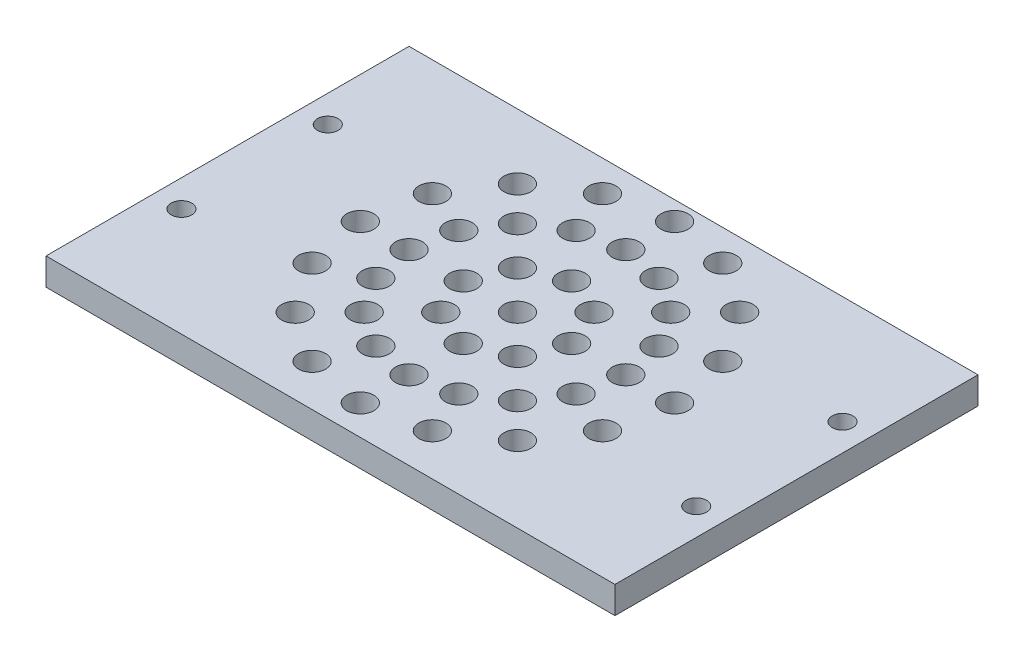
from build123d import *

# Parameters (mm, degrees)
SKETCH1_W           = 133.35
SKETCH1_H           = 85.09
BOSS_EXTRUDE1_DEPTH = 6.35
SKETCH2_R           = 2.413
CUT_EXTRUDE1_DEPTH  = 101.417876049
SKETCH3_R           = 3.175
CUT_EXTRUDE7_DEPTH  = 101.417876049


with BuildPart() as part:
    # Sketch1 → Boss-Extrude1 (new body)
    with BuildSketch(Plane(origin=(0, 0, 0), x_dir=(1, 0, 0), z_dir=(0, 1, 0))):
        with Locations((21.486627907, 5.109534884)):
            Rectangle(SKETCH1_W, SKETCH1_H)
    extrude(amount=BOSS_EXTRUDE1_DEPTH)

    # Sketch2 → Cut-Extrude1 (cut, through all)
    with BuildSketch(Plane(origin=(0, 6.35, 0), x_dir=(1, 0, 0), z_dir=(0, 1, 0))):
        with Locations((81.811627907, -12.035465116)):
            Circle(SKETCH2_R)
        with Locations((81.811627907, 22.254534884)):
            Circle(SKETCH2_R)
        with Locations((-38.838372093, 22.254534884)):
            Circle(SKETCH2_R)
        with Locations((-38.838372093, -12.035465116)):
            Circle(SKETCH2_R)
    extrude(amount=-CUT_EXTRUDE1_DEPTH, mode=Mode.SUBTRACT)

    # Sketch3 → Cut-Extrude7 (cut, through all)
    with BuildSketch(Plane(origin=(0, 6.35, 0), x_dir=(1, 0, 0), z_dir=(0, 1, 0))):
        with Locations((21.486627907, 6.379534884)):
            Circle(SKETCH3_R)
        with Locations((34.186627907, 6.379534884)):
            Circle(SKETCH3_R)
        with Locations((46.886627907, 6.379534884)):
            Circle(SKETCH3_R)
        with Locations((30.466884028, -2.600721237)):
            Circle(SKETCH3_R)
        with Locations((21.486627907, -6.320465116)):
            Circle(SKETCH3_R)
        with Locations((12.506371786, -2.600721237)):
            Circle(SKETCH3_R)
        with Locations((8.786627907, 6.379534884)):
            Circle(SKETCH3_R)
        with Locations((12.506371786, 15.359791005)):
            Circle(SKETCH3_R)
        with Locations((21.486627907, 19.079534884)):
            Circle(SKETCH3_R)
        with Locations((30.466884028, 15.359791005)):
            Circle(SKETCH3_R)
        with Locations((44.953168033, -3.340624298)):
            Circle(SKETCH3_R)
        with Locations((39.447140149, -11.580977358)):
            Circle(SKETCH3_R)
        with Locations((31.206787089, -17.087005242)):
            Circle(SKETCH3_R)
        with Locations((21.486627907, -19.020465116)):
            Circle(SKETCH3_R)
        with Locations((11.766468725, -17.087005242)):
            Circle(SKETCH3_R)
        with Locations((3.526115665, -11.580977358)):
            Circle(SKETCH3_R)
        with Locations((-1.979912219, -3.340624298)):
            Circle(SKETCH3_R)
        with Locations((-3.913372093, 6.379534884)):
            Circle(SKETCH3_R)
        with Locations((-1.979912219, 16.099694066)):
            Circle(SKETCH3_R)
        with Locations((3.526115665, 24.340047126)):
            Circle(SKETCH3_R)
        with Locations((11.766468725, 29.84607501)):
            Circle(SKETCH3_R)
        with Locations((21.486627907, 31.779534884)):
            Circle(SKETCH3_R)
        with Locations((31.206787089, 29.84607501)):
            Circle(SKETCH3_R)
        with Locations((39.447140149, 24.340047126)):
            Circle(SKETCH3_R)
        with Locations((44.953168033, 16.099694066)):
            Circle(SKETCH3_R)
        with Locations((58.316627907, 6.379534884)):
            Circle(SKETCH3_R)
        with Locations((55.513111089, -7.71469593)):
            Circle(SKETCH3_R)
        with Locations((47.529370658, -19.663207867)):
            Circle(SKETCH3_R)
        with Locations((35.580858721, -27.646948299)):
            Circle(SKETCH3_R)
        with Locations((21.486627907, -30.450465116)):
            Circle(SKETCH3_R)
        with Locations((7.392397093, -27.646948299)):
            Circle(SKETCH3_R)
        with Locations((-4.556114844, -19.663207867)):
            Circle(SKETCH3_R)
        with Locations((-12.539855275, -7.71469593)):
            Circle(SKETCH3_R)
        with Locations((-15.343372093, 6.379534884)):
            Circle(SKETCH3_R)
        with Locations((-12.539855275, 20.473765698)):
            Circle(SKETCH3_R)
        with Locations((-4.556114844, 32.422277635)):
            Circle(SKETCH3_R)
        with Locations((7.392397093, 40.406018066)):
            Circle(SKETCH3_R)
        with Locations((21.486627907, 43.209534884)):
            Circle(SKETCH3_R)
        with Locations((35.580858721, 40.406018066)):
            Circle(SKETCH3_R)
        with Locations((47.529370658, 32.422277635)):
            Circle(SKETCH3_R)
        with Locations((55.513111089, 20.473765698)):
            Circle(SKETCH3_R)
    extrude(amount=-CUT_EXTRUDE7_DEPTH, mode=Mode.SUBTRACT)


solid = part.part
